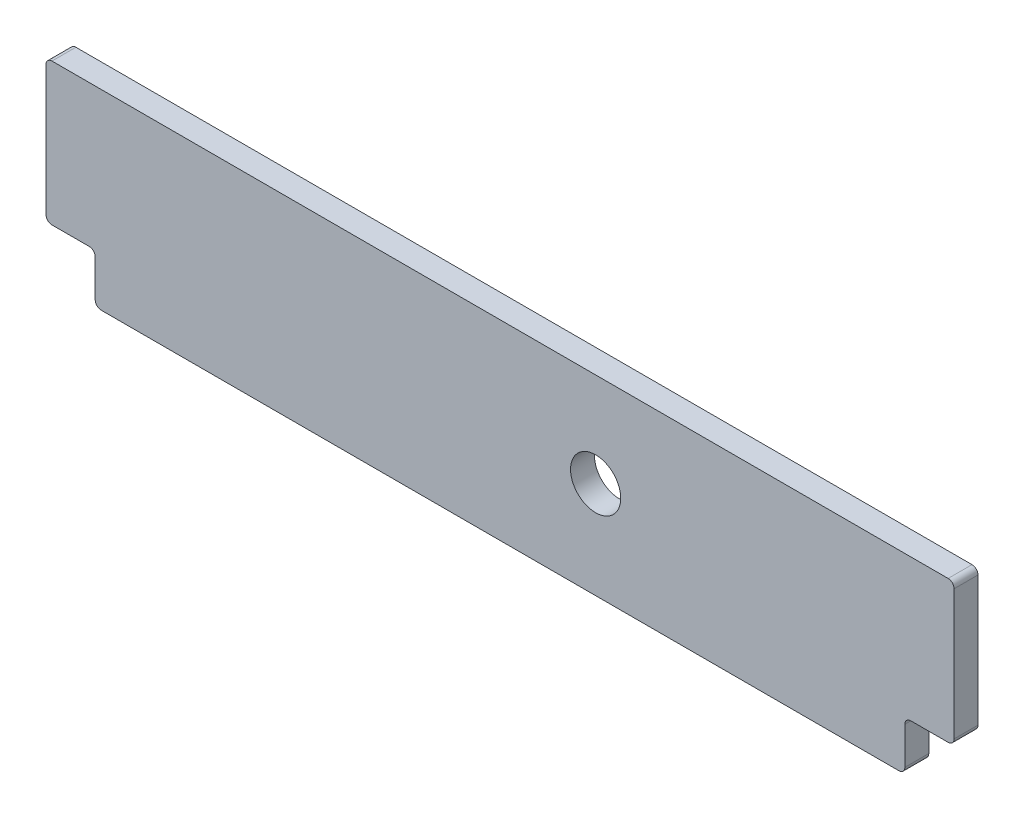
from build123d import *

# Parameters (mm, degrees)
BOSS_EXTRUDE1_DEPTH = 6.35
CAVITY1_START       = -6.35
CAVITY1_OUTLINE_R   = 12.7
CAVITY1_DEPTH       = 12.7
MOVE_FACE_SLOT_BY   = 0.762
MOVE_FACE_SLOT_2_BY = 0.762
MOVE_FACE_SLOT_3_BY = 0.762
MOVE_FACE_SLOT_4_BY = 0.762
FILLET1_R           = 3.175
MOVE_FACE_HOLE_BY   = 0.635


# Read off the part's stored shape, not the designer's step: Cavity1
with BuildPart() as part:
    # Sketch1 → Boss-Extrude1 (new, symmetric)
    with BuildSketch(Plane.XY):
        Polygon((-215.9, 0), (215.9, 0), (215.9, 25.4), (241.3, 25.4), (241.3, 101.6), (-241.3, 101.6), (-241.3, 25.4), (-215.9, 25.4), align=None)
    extrude(amount=BOSS_EXTRUDE1_DEPTH, both=True)

    # Cavity1 outline → Cavity1 (cut)
    with BuildSketch(Plane.XY.offset(CAVITY1_START)):
        with Locations((50.8, 51.5)):
            Circle(CAVITY1_OUTLINE_R)
    extrude(amount=CAVITY1_DEPTH, mode=Mode.SUBTRACT)

    # Move Face slot: a face moved inward by 0.762
    extrude(part.faces().sort_by_distance((-228.6, 25.4, 0))[0], amount=MOVE_FACE_SLOT_BY, dir=(0, 1, 0), mode=Mode.SUBTRACT)

    # Move Face slot 2: a face moved inward by 0.762
    extrude(part.faces().sort_by_distance((-215.9, 12.7, 0))[0], amount=MOVE_FACE_SLOT_2_BY, dir=(1, 0, 0), mode=Mode.SUBTRACT)

    # Move Face slot 3: a face moved inward by 0.762
    extrude(part.faces().sort_by_distance((215.9, 12.7, 0))[0], amount=MOVE_FACE_SLOT_3_BY, dir=(-1, 0, 0), mode=Mode.SUBTRACT)

    # Move Face slot 4: a face moved inward by 0.762
    extrude(part.faces().sort_by_distance((228.6, 25.4, 0))[0], amount=MOVE_FACE_SLOT_4_BY, dir=(0, 1, 0), mode=Mode.SUBTRACT)

    # Fillet1
    fillet1_edges = [part.edges().sort_by_distance(p)[0] for p in [
        (215.138, 0, 0),
        (215.138, 26.162, 0),
        (241.3, 26.162, 0),
        (241.3, 101.6, 0),
        (-241.3, 101.6, 0),
        (-241.3, 26.162, 0),
        (-215.138, 26.162, 0),
        (-215.138, 0, 0),
    ]]
    fillet(fillet1_edges, radius=FILLET1_R)

    # Move Face hole: a curved face moved inward by 0.635
    add(Solid.thicken(part.faces().sort_by_distance((38.1, 51.5, 0))[0], -MOVE_FACE_HOLE_BY), mode=Mode.SUBTRACT)


solid = part.part
